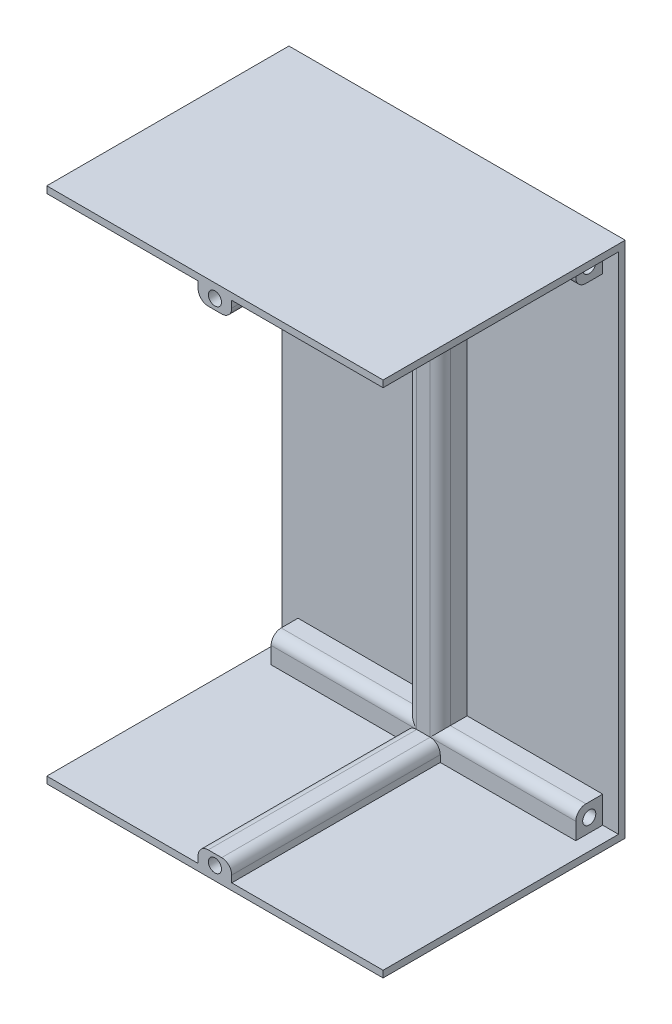
from build123d import *

# Parameters (mm, degrees)
SKETCH1_W           = 154
SKETCH1_H           = 100
BOSS_EXTRUDE1_DEPTH = 2
SKETCH2_W           = 100
SKETCH2_H           = 2
BOSS_EXTRUDE2_DEPTH = 70
SKETCH3_W           = 90.6
SKETCH3_H           = 8
BOSS_EXTRUDE3_DEPTH = 8
SKETCH4_W           = 10
SKETCH4_H           = 134
BOSS_EXTRUDE4_DEPTH = 8
SKETCH5_W           = 10
SKETCH5_H           = 5
BOSS_EXTRUDE5_DEPTH = 62
SKETCH6_R           = 1.95
CUT_EXTRUDE1_DEPTH  = 195.889943301
SKETCH7_R           = 1.95
CUT_EXTRUDE2_DEPTH  = 195.889943301
FILLET1_R           = 3
SKETCH8_R           = 1.95
CUT_EXTRUDE3_DEPTH  = 15
SKETCH9_R           = 1.95
CUT_EXTRUDE4_DEPTH  = 15
FILLET2_R           = 3


with BuildPart() as part:
    # Sketch1 → Boss-Extrude1 (new body)
    with BuildSketch(Plane(origin=(0, 0, 0), x_dir=(0, 1, 0), z_dir=(0, 0, 1))):
        with Locations((77, 50)):
            Rectangle(SKETCH1_W, SKETCH1_H)
    extrude(amount=BOSS_EXTRUDE1_DEPTH)

    # Sketch2 → Boss-Extrude2 (add)
    with BuildSketch(Plane.XY.offset(2)):
        with Locations((-50, 153)):
            Rectangle(SKETCH2_W, SKETCH2_H)
        with Locations((-50, 1)):
            Rectangle(SKETCH2_W, SKETCH2_H)
    extrude(amount=BOSS_EXTRUDE2_DEPTH)

    # Sketch3 → Boss-Extrude3 (add)
    with BuildSketch(Plane.XY.offset(2)):
        with Locations((-50, 148)):
            Rectangle(SKETCH3_W, SKETCH3_H)
        with Locations((-50, 6)):
            Rectangle(SKETCH3_W, SKETCH3_H)
    extrude(amount=BOSS_EXTRUDE3_DEPTH)

    # Sketch4 → Boss-Extrude4 (add)
    with BuildSketch(Plane.XY.offset(2)):
        with Locations((-50, 77)):
            Rectangle(SKETCH4_W, SKETCH4_H)
    extrude(amount=BOSS_EXTRUDE4_DEPTH)

    # Sketch5 → Boss-Extrude5 (add)
    with BuildSketch(Plane.XY.offset(10)):
        with Locations((-50, 149.5)):
            Rectangle(SKETCH5_W, SKETCH5_H)
        with Locations((-50, 4.5)):
            Rectangle(SKETCH5_W, SKETCH5_H)
    extrude(amount=BOSS_EXTRUDE5_DEPTH)

    # Sketch6 → Cut-Extrude1 (cut, through all)
    with BuildSketch(Plane(origin=(-95.3, 0, 0), x_dir=(0, -1, 0), z_dir=(-1, 0, 0))):
        with Locations((-6, 6)):
            Circle(SKETCH6_R)
    extrude(amount=-CUT_EXTRUDE1_DEPTH, mode=Mode.SUBTRACT)

    # Sketch7 → Cut-Extrude2 (cut, through all)
    with BuildSketch(Plane(origin=(-95.3, 0, 0), x_dir=(0, -1, 0), z_dir=(-1, 0, 0))):
        with Locations(Location((-148, 6, 0), (0, 0, 90))):
            Circle(SKETCH7_R)
    extrude(amount=-CUT_EXTRUDE2_DEPTH, mode=Mode.SUBTRACT)

    # Fillet1
    fillet1_edges = [part.edges().sort_by_distance(p)[0] for p in [
        (-75.15, 144, 10),
        (-24.85, 10, 10),
        (-75.15, 10, 10),
        (-24.85, 144, 10),
        (-55, 77, 10),
        (-45, 77, 10),
    ]]
    fillet(fillet1_edges, radius=FILLET1_R - 0.0001)  # a hair under: the kernel refuses the full size

    # Sketch8 → Cut-Extrude3 (cut)
    with BuildSketch(Plane.XY.offset(72)):
        with Locations((-50, 150)):
            Circle(SKETCH8_R)
    extrude(amount=-CUT_EXTRUDE3_DEPTH, mode=Mode.SUBTRACT)

    # Sketch9 → Cut-Extrude4 (cut)
    with BuildSketch(Plane.XY.offset(72)):
        with Locations((-50, 4)):
            Circle(SKETCH9_R)
    extrude(amount=-CUT_EXTRUDE4_DEPTH, mode=Mode.SUBTRACT)

    # Fillet2
    fillet2_edges = [part.edges().sort_by_distance(p)[0] for p in [
        (-45, 7, 41),
        (-55, 147, 41),
        (-45, 147, 41),
        (-55, 7, 41),
    ]]
    fillet(fillet2_edges, radius=FILLET2_R)


solid = part.part
